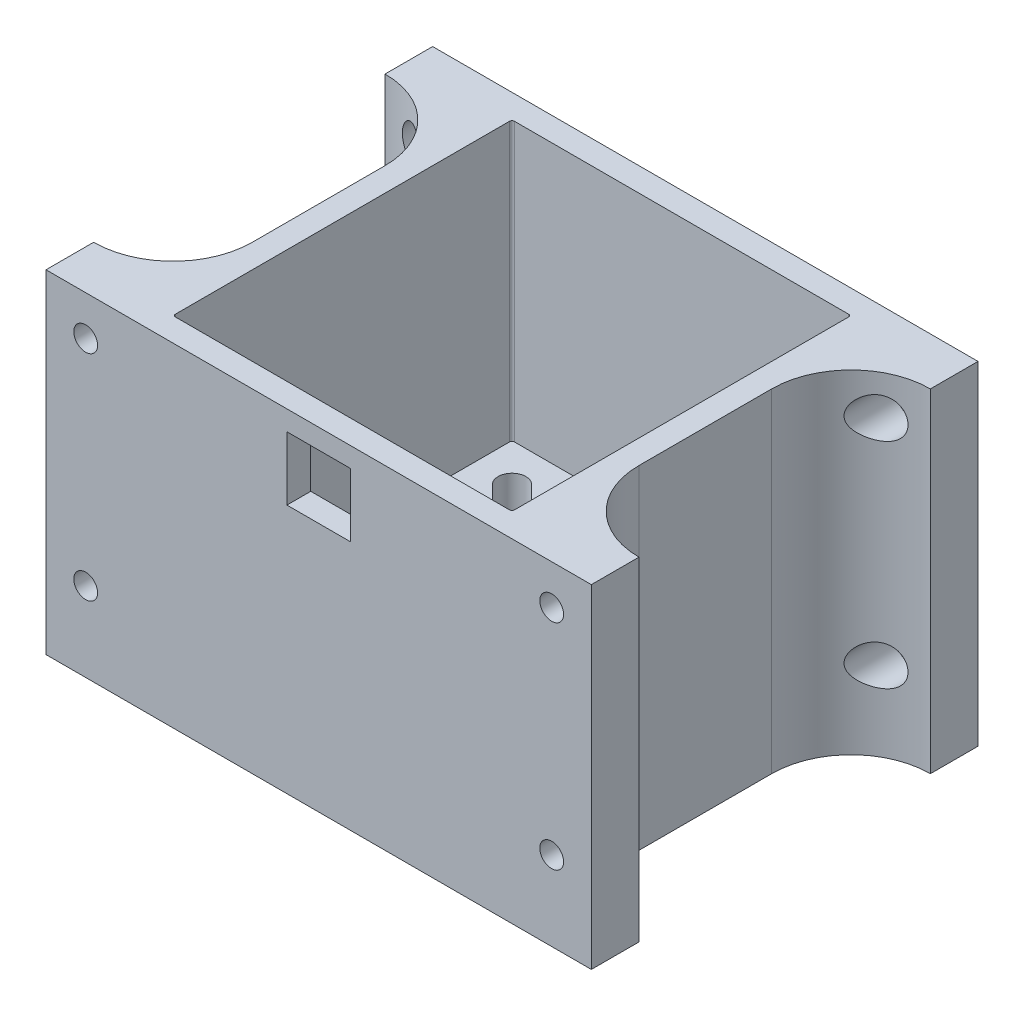
from build123d import *

# Parameters (mm, degrees)
BOSS_EXTRUDE1_DEPTH   = 7
SKETCH2_R             = 11
CUT_EXTRUDE1_DEPTH    = 2
SKETCH3_R             = 5.5
CUT_EXTRUDE2_DEPTH    = 4
SKETCH4_R             = 2.525
CUT_EXTRUDE3_DEPTH    = 35.971802277
SKETCH6_W             = 48.724264068
SKETCH6_H             = 48.724264068
BOSS_EXTRUDE2_DEPTH   = 35
SKETCH8_W             = 8
SKETCH8_H             = 8
CUT_EXTRUDE4_DEPTH    = 3
SKETCH9_R             = 1.5
BOSS_EXTRUDE4_DEPTH   = 6
FILLET1_R             = 10
SKETCH10_R            = 2.5
CUT_EXTRUDE5_DEPTH    = 7
MIRROR2_START         = -24.362132034
MIRROR2_OUTLINE_W     = 10
MIRROR2_OUTLINE_H     = 42
MIRROR2_OUTLINE_R     = 2.5
MIRROR2_DEPTH         = 16.0000001
MIRROR2_2_OUTLINE_R   = 2.5
MIRROR2_2_OUTLINE_R_2 = 1.5
MIRROR2_2_DEPTH       = 3
MIRROR2_3_DEPTH       = 42


with BuildPart() as part:
    # Sketch1 → Boss-Extrude1 (new body)
    # profile 1 of 2: a face of its own
    with BuildSketch(Plane(origin=(0, 0, 0), x_dir=(1, 0, 0), z_dir=(0, 1, 0))):
        Polygon((-24.362132034, 21.062132034), (-24.362132034, -21.062132034), (-24.362132034, -24.362132034), (-21.062132034, -24.362132034), (21.062132034, -24.362132034), (24.362132034, -24.362132034), (24.362132034, -21.062132034), (24.362132034, 21.062132034), (24.362132034, 24.362132034), (21.062132034, 24.362132034), (-21.062132034, 24.362132034), (-24.362132034, 24.362132034), align=None)
        with BuildLine():
            Line((21.062132034, -21.362132034), (-21.062132034, -21.362132034))
            ThreePointArc((-21.062132034, -21.362132034), (-21.274264069, -21.274264069), (-21.362132034, -21.062132034))
            Line((-21.362132034, -21.062132034), (-21.362132034, 21.062132034))
            ThreePointArc((-21.362132034, 21.062132034), (-21.274264069, 21.274264069), (-21.062132034, 21.362132034))
            Line((-21.062132034, 21.362132034), (21.062132034, 21.362132034))
            ThreePointArc((21.062132034, 21.362132034), (21.274264069, 21.274264069), (21.362132034, 21.062132034))
            Line((21.362132034, 21.062132034), (21.362132034, -21.062132034))
            ThreePointArc((21.362132034, -21.062132034), (21.274264069, -21.274264069), (21.062132034, -21.362132034))
        make_face(mode=Mode.SUBTRACT)
    # profile 2 of 2: a face of its own
    with BuildSketch(Plane(origin=(0, 0, 0), x_dir=(1, 0, 0), z_dir=(0, 1, 0))):
        with BuildLine():
            Line((-21.062132034, 21.362132034), (21.062132034, 21.362132034))
            ThreePointArc((21.062132034, 21.362132034), (21.274264069, 21.274264069), (21.362132034, 21.062132034))
            Line((21.362132034, 21.062132034), (21.362132034, -21.062132034))
            ThreePointArc((21.362132034, -21.062132034), (21.274264069, -21.274264069), (21.062132034, -21.362132034))
            Line((21.062132034, -21.362132034), (-21.062132034, -21.362132034))
            ThreePointArc((-21.062132034, -21.362132034), (-21.274264069, -21.274264069), (-21.362132034, -21.062132034))
            Line((-21.362132034, -21.062132034), (-21.362132034, 21.062132034))
            ThreePointArc((-21.362132034, 21.062132034), (-21.274264069, 21.274264069), (-21.062132034, 21.362132034))
        make_face()
        with BuildLine():
            Line((-17.798097039, -15.323223305), (-15.676776695, -13.201902961))
            ThreePointArc((-15.676776695, -13.201902961), (-13.201902961, -13.201902961), (-13.201902961, -15.676776695))
            Line((-13.201902961, -15.676776695), (-15.323223305, -17.798097039))
            ThreePointArc((-15.323223305, -17.798097039), (-17.798097039, -17.798097039), (-17.798097039, -15.323223305))
        make_face(mode=Mode.SUBTRACT)
        with BuildLine():
            Line((17.798097039, 15.323223305), (15.676776695, 13.201902961))
            ThreePointArc((15.676776695, 13.201902961), (13.201902961, 13.201902961), (13.201902961, 15.676776695))
            Line((13.201902961, 15.676776695), (15.323223305, 17.798097039))
            ThreePointArc((15.323223305, 17.798097039), (17.798097039, 17.798097039), (17.798097039, 15.323223305))
        make_face(mode=Mode.SUBTRACT)
        with BuildLine():
            ThreePointArc((-15.676776695, 13.201902961), (-13.201902961, 13.201902961), (-13.201902961, 15.676776695))
            Line((-13.201902961, 15.676776695), (-15.323223305, 17.798097039))
            ThreePointArc((-15.323223305, 17.798097039), (-17.798097039, 17.798097039), (-17.798097039, 15.323223305))
            Line((-17.798097039, 15.323223305), (-15.676776695, 13.201902961))
        make_face(mode=Mode.SUBTRACT)
        with BuildLine():
            ThreePointArc((15.676776695, -13.201902961), (13.201902961, -13.201902961), (13.201902961, -15.676776695))
            Line((13.201902961, -15.676776695), (15.323223305, -17.798097039))
            ThreePointArc((15.323223305, -17.798097039), (17.798097039, -17.798097039), (17.798097039, -15.323223305))
            Line((17.798097039, -15.323223305), (15.676776695, -13.201902961))
        make_face(mode=Mode.SUBTRACT)
    extrude(amount=BOSS_EXTRUDE1_DEPTH)

    # Sketch2 → Cut-Extrude1 (cut)
    with BuildSketch(Plane(origin=(0, 7, 0), x_dir=(1, 0, 0), z_dir=(0, 1, 0))):
        with Locations(Location((0, 0, 0), (0, 0, 270))):
            Circle(SKETCH2_R)
    extrude(amount=-CUT_EXTRUDE1_DEPTH, mode=Mode.SUBTRACT)

    # Sketch3 → Cut-Extrude2 (cut)
    with BuildSketch(Plane(origin=(0, 5, 0), x_dir=(1, 0, 0), z_dir=(0, 1, 0))):
        with Locations(Location((0, 0, 0), (0, 0, 270))):
            Circle(SKETCH3_R)
    extrude(amount=-CUT_EXTRUDE2_DEPTH, mode=Mode.SUBTRACT)

    # Sketch4 → Cut-Extrude3 (cut, through all)
    with BuildSketch(Plane(origin=(0, 1, 0), x_dir=(1, 0, 0), z_dir=(0, 1, 0))):
        with Locations(Location((0, 0, 0), (0, 0, 270))):
            Circle(SKETCH4_R)
    extrude(amount=-CUT_EXTRUDE3_DEPTH, mode=Mode.SUBTRACT)

    # Sketch6 → Boss-Extrude2 (add)
    with BuildSketch(Plane(origin=(0, 7, 0), x_dir=(1, 0, 0), z_dir=(0, 1, 0))):
        Rectangle(SKETCH6_W, SKETCH6_H)
        with BuildLine():
            Line((-21.062132034, -21.362132034), (21.062132034, -21.362132034))
            ThreePointArc((21.062132034, -21.362132034), (21.274264069, -21.274264069), (21.362132034, -21.062132034))
            Line((21.362132034, -21.062132034), (21.362132034, 21.062132034))
            ThreePointArc((21.362132034, 21.062132034), (21.274264069, 21.274264069), (21.062132034, 21.362132034))
            Line((21.062132034, 21.362132034), (-21.062132034, 21.362132034))
            ThreePointArc((-21.062132034, 21.362132034), (-21.274264069, 21.274264069), (-21.362132034, 21.062132034))
            Line((-21.362132034, 21.062132034), (-21.362132034, -21.062132034))
            ThreePointArc((-21.362132034, -21.062132034), (-21.274264069, -21.274264069), (-21.062132034, -21.362132034))
        make_face(mode=Mode.SUBTRACT)
    extrude(amount=BOSS_EXTRUDE2_DEPTH)

    # Sketch8 → Cut-Extrude4 (cut)
    with BuildSketch(Plane.XY.offset(24.362132034)):
        with Locations((0, 35.5)):
            Rectangle(SKETCH8_W, SKETCH8_H)
    extrude(amount=-CUT_EXTRUDE4_DEPTH, mode=Mode.SUBTRACT)

    # Sketch9 → Boss-Extrude4 (add)
    with BuildSketch(Plane.XY.offset(24.362132034)):
        Polygon((24.362132034, 0), (34.362132034, 0), (34.362132034, 5), (34.362132034, 15), (34.362132034, 32), (34.362132034, 42), (24.362132034, 42), align=None)
        with Locations((29.362132034, 10)):
            Circle(SKETCH9_R, mode=Mode.SUBTRACT)
        with Locations((29.362132034, 37)):
            Circle(SKETCH9_R, mode=Mode.SUBTRACT)
    boss_extrude4 = extrude(amount=-BOSS_EXTRUDE4_DEPTH)

    # Mirror1: Boss-Extrude4 across plane
    add(boss_extrude4.mirror(Plane(origin=(0, 0, 0), x_dir=(0, 0, 1), z_dir=(1, 0, 0))))

    # Fillet1
    # the kernel refuses this fillet: 10 mm, written as the material it adds along each edge
    with BuildSketch(Plane(origin=(-24.362132034, 42, 18.362132034), x_dir=(0, 0, -1), z_dir=(0, -1, 0))) as fillet1_piece_1_section:
        with BuildLine():
            CenterArc((FILLET1_R, -FILLET1_R), FILLET1_R, 90, 90)
            Line((0, -FILLET1_R), (0, 0))
            Line((0, 0), (FILLET1_R, 0))
        make_face()
    fillet1_piece_1 = extrude(amount=42, mode=Mode.PRIVATE)
    fillet1_piece_1 = fillet1_piece_1 - Plane(origin=(-29.362132034, 10, 18.362132034), x_dir=(-1, 0, 0), z_dir=(0, 0, 1)) * Cylinder(1.5, 124, mode=Mode.PRIVATE)
    fillet1_piece_1 = fillet1_piece_1 - Plane(origin=(-29.362132034, 37, 18.362132034), x_dir=(-1, 0, 0), z_dir=(0, 0, 1)) * Cylinder(1.5, 124, mode=Mode.PRIVATE)
    add(fillet1_piece_1)
    with BuildSketch(Plane(origin=(24.362132034, 42, 18.362132034), x_dir=(1, 0, 0), z_dir=(0, -1, 0))) as fillet1_piece_2_section:
        with BuildLine():
            CenterArc((FILLET1_R, -FILLET1_R), FILLET1_R, 90, 90)
            Line((0, -FILLET1_R), (0, 0))
            Line((0, 0), (FILLET1_R, 0))
        make_face()
    fillet1_piece_2 = extrude(amount=42, mode=Mode.PRIVATE)
    fillet1_piece_2 = fillet1_piece_2 - Plane(origin=(29.362132034, 10, 18.362132034), x_dir=(1, 0, 0), z_dir=(0, 0, 1)) * Cylinder(1.5, 124, mode=Mode.PRIVATE)
    fillet1_piece_2 = fillet1_piece_2 - Plane(origin=(29.362132034, 37, 18.362132034), x_dir=(1, 0, 0), z_dir=(0, 0, 1)) * Cylinder(1.5, 124, mode=Mode.PRIVATE)
    add(fillet1_piece_2)

    # Sketch10 → Cut-Extrude5 (cut)
    with BuildSketch(Plane.XY.offset(14.362132034)):
        with Locations(Location((-29.362132034, 37, 0), (0, 0, 180))):
            Circle(SKETCH10_R)
        with Locations(Location((-29.362132034, 10, 0), (0, 0, 180))):
            Circle(SKETCH10_R)
        with Locations(Location((29.362132034, 37, 0), (0, 0, 180))):
            Circle(SKETCH10_R)
        with Locations(Location((29.362132034, 10, 0), (0, 0, 180))):
            Circle(SKETCH10_R)
    extrude(amount=CUT_EXTRUDE5_DEPTH, mode=Mode.SUBTRACT)

    # Mirror2: read off the stored shape, not the designer's step
    # Mirror2 outline → Mirror2 (add)
    # profile 1 of 2: a face of its own
    with BuildSketch(Plane.XY.offset(MIRROR2_START)):
        with Locations((29.362132034, 21)):
            Rectangle(MIRROR2_OUTLINE_W, MIRROR2_OUTLINE_H)
        with Locations((29.362132034, 10)):
            Circle(MIRROR2_OUTLINE_R, mode=Mode.SUBTRACT)
        with Locations((29.362132034, 37)):
            Circle(MIRROR2_OUTLINE_R, mode=Mode.SUBTRACT)
    # profile 2 of 2: a face of its own
    with BuildSketch(Plane.XY.offset(MIRROR2_START)):
        with Locations((-29.362132034, 21)):
            Rectangle(MIRROR2_OUTLINE_W, MIRROR2_OUTLINE_H)
        with Locations((-29.362132034, 10)):
            Circle(MIRROR2_OUTLINE_R, mode=Mode.SUBTRACT)
        with Locations((-29.362132034, 37)):
            Circle(MIRROR2_OUTLINE_R, mode=Mode.SUBTRACT)
    extrude(amount=MIRROR2_DEPTH)

    # Mirror2 2 outline → Mirror2 2 (add)
    # profile 1 of 4: a face of its own
    with BuildSketch(Plane.XY.offset(MIRROR2_START)):
        with Locations((29.362132034, 10)):
            Circle(MIRROR2_2_OUTLINE_R)
        with Locations((29.362132034, 10)):
            Circle(MIRROR2_2_OUTLINE_R_2, mode=Mode.SUBTRACT)
    # profile 2 of 4: a face of its own
    with BuildSketch(Plane.XY.offset(MIRROR2_START)):
        with Locations((29.362132034, 37)):
            Circle(MIRROR2_2_OUTLINE_R)
        with Locations((29.362132034, 37)):
            Circle(MIRROR2_2_OUTLINE_R_2, mode=Mode.SUBTRACT)
    # profile 3 of 4: a face of its own
    with BuildSketch(Plane.XY.offset(MIRROR2_START)):
        with Locations((-29.362132034, 37)):
            Circle(MIRROR2_2_OUTLINE_R)
        with Locations((-29.362132034, 37)):
            Circle(MIRROR2_2_OUTLINE_R_2, mode=Mode.SUBTRACT)
    # profile 4 of 4: a face of its own
    with BuildSketch(Plane.XY.offset(MIRROR2_START)):
        with Locations((-29.362132034, 10)):
            Circle(MIRROR2_2_OUTLINE_R)
        with Locations((-29.362132034, 10)):
            Circle(MIRROR2_2_OUTLINE_R_2, mode=Mode.SUBTRACT)
    extrude(amount=MIRROR2_2_DEPTH)

    # Mirror2 3 outline → Mirror2 3 (cut)
    with BuildSketch(Plane(origin=(0, 0, 0), x_dir=(1, 0, 0), z_dir=(0, 1, 0))):
        with BuildLine():
            Line((-34.362132034, 8.362131934), (-24.362132034, 8.362132034))
            ThreePointArc((-24.362132034, 8.362132034), (-27.291064222, 15.433199846), (-34.362132034, 18.362132034))
            Line((-34.362132034, 18.362132034), (-34.362132034, 8.362131934))
        make_face()
        with BuildLine():
            Line((34.362132034, 8.362131934), (34.362132034, 18.362132034))
            ThreePointArc((34.362132034, 18.362132034), (27.291064222, 15.433199846), (24.362132034, 8.362132034))
            Line((24.362132034, 8.362132034), (34.362132034, 8.362131934))
        make_face()
    extrude(amount=MIRROR2_3_DEPTH, mode=Mode.SUBTRACT)


solid = part.part
